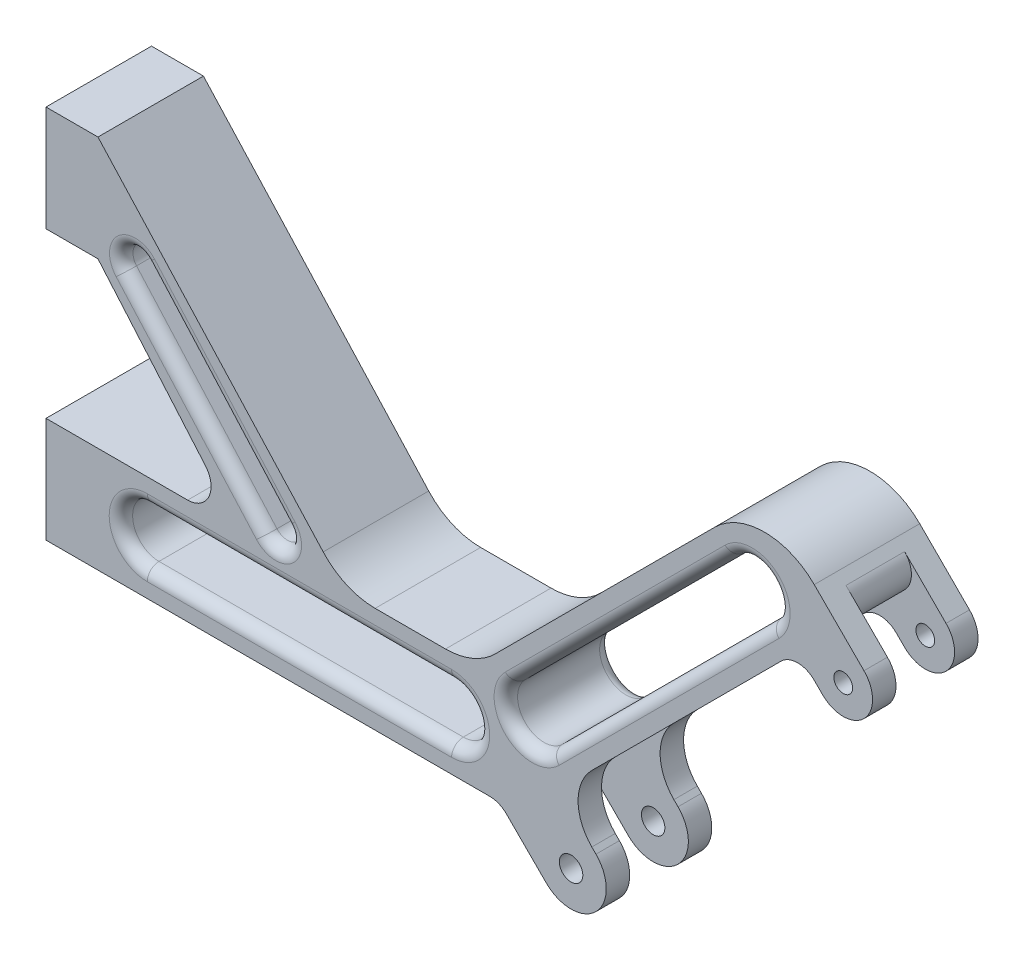
from build123d import *

# Parameters (mm, degrees)
SKETCH1_W            = 45
SKETCH1_H            = 45
SKETCH5_R            = 5
SKETCH5_R_2          = 4
BOSS_EXTRUDE2_DEPTH  = 10
FILLET2_R            = 15
FILLET2_OF_MIRROR1_R = 15
FILLET3_R            = 10
FILLET4_R            = 30
FILLET5_R            = 30
CUT_EXTRUDE1_DEPTH   = 366.442982877
FILLET6_R            = 5
FILLET7_R            = 20
FILLET8_R            = 25
FILLET10_R           = 5
FILLET11_R           = 10
FILLET12_R           = 30
SKETCH9_W            = 45
SKETCH9_H            = 45
BOSS_EXTRUDE3_DEPTH  = 22.16
FILLET13_R           = 12.5


# Some blends are built 0.0001 mm under size
with BuildPart() as part:
    # Sweep1: sweep along a path in Sketch2
    with BuildLine(Plane.XY) as sweep1_path:
        Line((0, 0), (170, 0))
        Line((170, 0), (300.22970773, 130.22970773))
    # Sketch1 → Sweep1 (sweep)
    with BuildSketch(Plane(origin=(0, 0, 0), x_dir=(0, 0, -1), z_dir=(1, 0, 0))):
        Rectangle(SKETCH1_W, SKETCH1_H)
    sweep(path=sweep1_path.line, transition=Transition.RIGHT)

    # Sketch5 → Boss-Extrude2 (add)
    # profile 1 of 2: a face of its own
    with BuildSketch(Plane.XY.offset(22.5)):
        Polygon((201.819805153, -53.033008589), (159.393398282, -10.606601718), (180.606601718, 10.606601718), (223.033008589, -31.819805153), align=None)
        with Locations((201.819805153, -31.819805153)):
            Circle(SKETCH5_R, mode=Mode.SUBTRACT)
    # profile 2 of 2: a face of its own
    with BuildSketch(Plane.XY.offset(22.5)):
        Polygon((300.22970773, 130.22970773), (335.585046792, 94.874368674), (317.907377264, 77.196699143), (282.552038203, 112.552038203), align=None)
        with Locations((317.907377263, 94.874368672)):
            Circle(SKETCH5_R_2, mode=Mode.SUBTRACT)
    boss_extrude2 = extrude(amount=-BOSS_EXTRUDE2_DEPTH)

    # Fillet2
    fillet2_edges = [part.edges().sort_by_distance(p)[0] for p in [
        (201.819805153, -53.033008589, 17.5),
        (223.033008589, -31.819805153, 17.5),
    ]]
    fillet(fillet2_edges, radius=FILLET2_R - 0.0001)  # a hair under: the kernel refuses the full size

    # Mirror1: Boss-Extrude2 across plane
    add(boss_extrude2.mirror(Plane.XY))

    # Fillet2 of Mirror1
    fillet2_of_mirror1_edges = [part.edges().sort_by_distance(p)[0] for p in [
        (201.819805153, -53.033008589, -17.5),
        (223.033008589, -31.819805153, -17.5),
    ]]
    fillet(fillet2_of_mirror1_edges, radius=FILLET2_OF_MIRROR1_R - 0.0001)  # a hair under: the kernel refuses the full size

    # Sketch6 → Loft1 section 0
    with BuildSketch(Plane(origin=(0, 22.5, 0), x_dir=(1, 0, 0), z_dir=(0, 1, 0))):
        with BuildLine():
            Line((60, 22.5), (105, 22.5))
            Line((105, 22.5), (105, -22.5))
            Line((105, -22.5), (60, -22.5))
            Line((60, -22.5), (60, 22.5))
        make_face()
    # Sketch7 → Loft1 section 1
    with BuildSketch(Plane.ZY):
        with BuildLine():
            Line((-22.5, 137.5), (22.5, 137.5))
            Line((22.5, 137.5), (22.5, 92.5))
            Line((22.5, 92.5), (-22.5, 92.5))
            Line((-22.5, 92.5), (-22.5, 137.5))
        make_face()
    loft()

    # Fillet3
    fillet3_edges = [part.edges().sort_by_distance(p)[0] for p in [
        (60, 22.5, 0),
        (298.46194078, 96.642135627, 17.5),
        (298.46194078, 96.642135627, -17.5),
        (171.286796564, -22.5, -17.5),
        (171.286796564, -22.5, 17.5),
    ]]
    fillet(fillet3_edges, radius=FILLET3_R)

    # Fillet4
    fillet4_edges = [part.edges().sort_by_distance(p)[0] for p in [
        (284.319805153, 146.139610307, 0),
    ]]
    fillet(fillet4_edges, radius=FILLET4_R)

    # Fillet5
    fillet5_edges = [part.edges().sort_by_distance(p)[0] for p in [
        (105, 22.5, 0),
    ]]
    fillet(fillet5_edges, radius=FILLET5_R)

    # Sketch8 → Cut-Extrude1 (cut, through all)
    with BuildSketch(Plane.XY.offset(22.5)):
        with BuildLine():
            Line((150.8391696, 11.25), (21.038638364, 11.25))
            ThreePointArc((21.038638364, 11.25), (9.788638364, 0), (21.038638364, -11.25))
            Line((21.038638364, -11.25), (150.8391696, -11.25))
            ThreePointArc((150.8391696, -11.25), (162.0891696, 0), (150.8391696, 11.25))
        make_face()
        with BuildLine():
            Line((271.061553006, 116.971455583), (177.289149721, 23.199052298))
            ThreePointArc((177.289149721, 23.199052298), (177.289149721, 7.289149721), (193.199052298, 7.289149721))
            Line((193.199052298, 7.289149721), (286.971455583, 101.061553006))
            ThreePointArc((286.971455583, 101.061553006), (286.971455583, 116.971455583), (271.061553006, 116.971455583))
        make_face()
        with BuildLine():
            Line((80.321624137, 33.956643426), (20.416287911, 101.123232529))
            ThreePointArc((20.416287911, 101.123232529), (11.944826222, 101.607316054), (11.460742697, 93.135854365))
            Line((11.460742697, 93.135854365), (71.366078924, 25.969265263))
            ThreePointArc((71.366078924, 25.969265263), (75.501552787, 23.972726338), (79.837540612, 25.485181738))
            ThreePointArc((79.837540612, 25.485181738), (81.834079537, 29.620655601), (80.321624137, 33.956643426))
        make_face()
    extrude(amount=-CUT_EXTRUDE1_DEPTH, mode=Mode.SUBTRACT)

    # Fillet6
    fillet6_edges = [part.edges().sort_by_distance(p)[0] for p in [
        (85.938903982, -11.25, -22.5),
        (162.0891696, 0, -22.5),
        (85.938903982, 11.25, -22.5),
        (9.788638364, 0, -22.5),
        (286.971455583, 116.971455583, -22.5),
        (224.175351363, 70.08525394, -22.5),
        (177.289149721, 7.289149721, -22.5),
        (240.08525394, 54.175351363, -22.5),
        (224.175351363, 70.08525394, 22.5),
        (240.08525394, 54.175351363, 22.5),
        (286.971455583, 116.971455583, 22.5),
        (177.289149721, 7.289149721, 22.5),
        (50.368956024, 67.539937978, 22.5),
        (41.41341081, 59.552559814, 22.5),
        (79.837540612, 25.485181738, 22.5),
        (11.944826222, 101.607316054, 22.5),
        (85.938903982, 11.25, 22.5),
        (9.788638364, 0, 22.5),
        (85.938903982, -11.25, 22.5),
        (162.0891696, 0, 22.5),
    ]]
    fillet(fillet6_edges, radius=FILLET6_R)

    # Fillet7
    fillet7_edges = [part.edges().sort_by_distance(p)[0] for p in [
        (196.516504294, -5.303300859, -17.5),
        (196.516504294, -5.303300859, 17.5),
    ]]
    fillet(fillet7_edges, radius=FILLET7_R)

    # Fillet8
    fillet8_edges = [part.edges().sort_by_distance(p)[0] for p in [
        (179.319805153, -22.5, 0),
    ]]
    fillet(fillet8_edges, radius=FILLET8_R)

    # Fillet10
    fillet10_edges = [part.edges().sort_by_distance(p)[0] for p in [
        (79.837540612, 25.485181738, -22.5),
        (50.368956024, 67.539937978, -22.5),
        (11.944826222, 101.607316054, -22.5),
        (41.41341081, 59.552559814, -22.5),
    ]]
    fillet(fillet10_edges, radius=FILLET10_R)

    # Fillet11
    # the kernel refuses this fillet: 10 mm, written as the material it takes off along each edge
    with BuildSketch(Plane(origin=(316.139610307, 114.319805153, 12.5), x_dir=(-0.7071067811865511, -0.707106781186544, 0), z_dir=(0, 0, -1))) as fillet11_piece_1:
        with BuildLine():
            CenterArc((FILLET11_R, FILLET11_R), FILLET11_R, 180, 90)
            Line((0, FILLET11_R), (0, 0))
            Line((0, 0), (FILLET11_R, 0))
        make_face()
    extrude(amount=25, mode=Mode.SUBTRACT)

    # Fillet12
    fillet12_edges = [part.edges().sort_by_distance(p)[0] for p in [
        (160.680194847, 22.5, 0),
    ]]
    fillet(fillet12_edges, radius=FILLET12_R)

    # Sketch9 → Boss-Extrude3 (add)
    with BuildSketch(Plane.ZY):
        Rectangle(SKETCH9_W, SKETCH9_H)
        with Locations((0, 115)):
            Rectangle(SKETCH9_W, SKETCH9_H)
    extrude(amount=BOSS_EXTRUDE3_DEPTH)

    # Fillet13
    fillet13_edges = [part.edges().sort_by_distance(p)[0] for p in [
        (335.585046792, 94.874368674, -17.5),
        (317.907377264, 77.196699143, -17.5),
        (317.907377264, 77.196699143, 17.5),
        (335.585046792, 94.874368674, 17.5),
    ]]
    fillet(fillet13_edges, radius=FILLET13_R - 0.0001)  # a hair under: the kernel refuses the full size


solid = part.part
